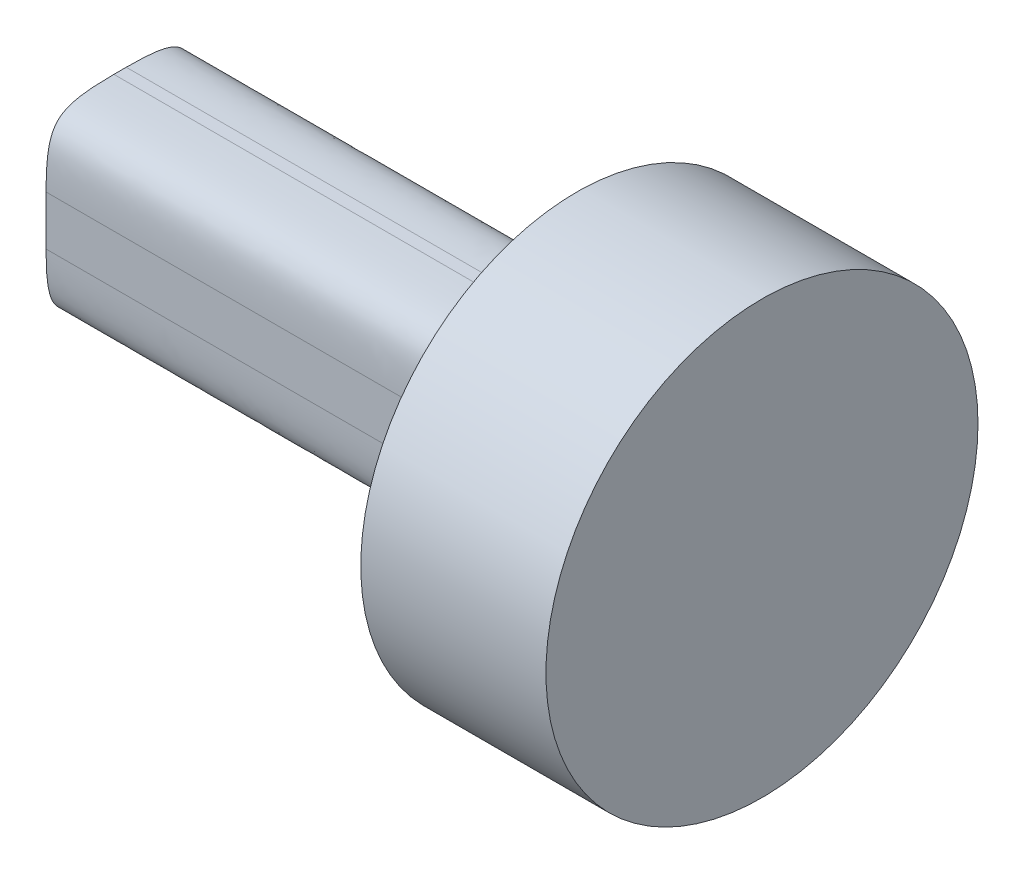
from build123d import *

# Parameters (mm, degrees)
SKETCH2_W           = 37
SKETCH2_H           = 15
BOSS_EXTRUDE1_DEPTH = 12
SKETCH3_R           = 17.5
BOSS_EXTRUDE2_DEPTH = 15
FILLET1_SIZE        = 5.5


with BuildPart() as part:
    # Sketch2 → Boss-Extrude1 (new body)
    with BuildSketch(Plane.XY):
        with Locations((-165.97258371, 72.296511628)):
            Rectangle(SKETCH2_W, SKETCH2_H)
    extrude(amount=BOSS_EXTRUDE1_DEPTH)

    # Sketch3 → Boss-Extrude2 (add)
    with BuildSketch(Plane(origin=(-147.47258371, 0, 0), x_dir=(0, 0, -1), z_dir=(1, 0, 0))):
        with Locations((-6, 72.296511628)):
            Circle(SKETCH3_R)
    extrude(amount=BOSS_EXTRUDE2_DEPTH)

    # Fillet1
    # a fillet whose section is not a circle: 5.5 mm, written as the material it takes off along each edge
    with BuildSketch(Plane(origin=(-147.47258371, 64.796511628, 0), x_dir=(0, 0, 1), z_dir=(-1, 0, 0)), Plane(origin=(-147.47258371, 64.796511628, 12), x_dir=(0, 1, 0), z_dir=(-1, 0, 0)), Plane(origin=(-198.22258371, 79.796511628, 0), x_dir=(0, 0, 1), z_dir=(1, 0, 0))) as fillet1_piece_1:
        with BuildLine():
            Bezier((FILLET1_SIZE, 0), (0, 0), (0, FILLET1_SIZE), weights=[1, 1.857142857, 1])
            Line((0, FILLET1_SIZE), (0, 0))
            Line((0, 0), (FILLET1_SIZE, 0))
        make_face()
    extrude(amount=50.75, mode=Mode.SUBTRACT)
    with BuildSketch(Plane(origin=(-198.22258371, 79.796511628, 12), x_dir=(0, 0, -1), z_dir=(1, 0, 0))) as fillet1_piece_2:
        with BuildLine():
            Bezier((FILLET1_SIZE, 0), (0, 0), (0, -FILLET1_SIZE), weights=[1, 1.857142857, 1])
            Line((0, -FILLET1_SIZE), (0, 0))
            Line((0, 0), (FILLET1_SIZE, 0))
        make_face()
    extrude(amount=50.75, mode=Mode.SUBTRACT)


solid = part.part
